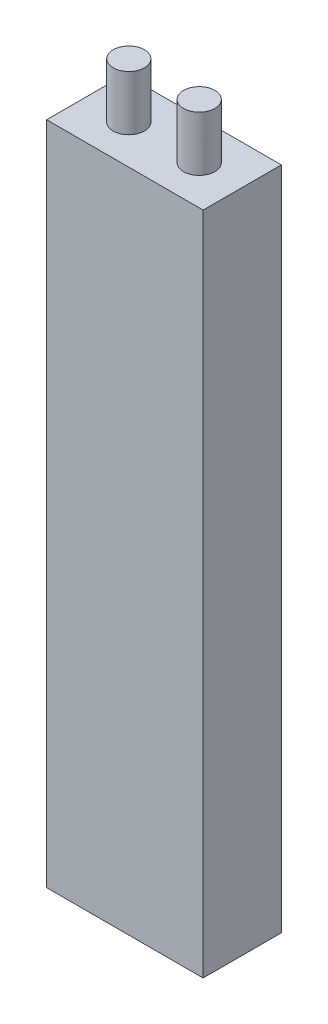
from build123d import *

# Parameters (mm, degrees)
SKETCH1_W           = 50.8
SKETCH1_H           = 25.4
BOSS_EXTRUDE1_DEPTH = 215.9
SKETCH2_R           = 5.08
BOSS_EXTRUDE2_DEPTH = 17.78


with BuildPart() as part:
    # Sketch1 → Boss-Extrude1 (new body)
    with BuildSketch(Plane(origin=(0, 0, 0), x_dir=(1, 0, 0), z_dir=(0, 1, 0))):
        with Locations((4.057987906, 2.028993953)):
            Rectangle(SKETCH1_W, SKETCH1_H)
    extrude(amount=BOSS_EXTRUDE1_DEPTH)

    # Sketch2 → Boss-Extrude2 (add)
    with BuildSketch(Plane(origin=(0, 215.9, 0), x_dir=(1, 0, 0), z_dir=(0, 1, 0))):
        with Locations((15.487987906, 2.028993953)):
            Circle(SKETCH2_R)
        with Locations((-7.372012094, 2.028993953)):
            Circle(SKETCH2_R)
    extrude(amount=BOSS_EXTRUDE2_DEPTH)


solid = part.part
